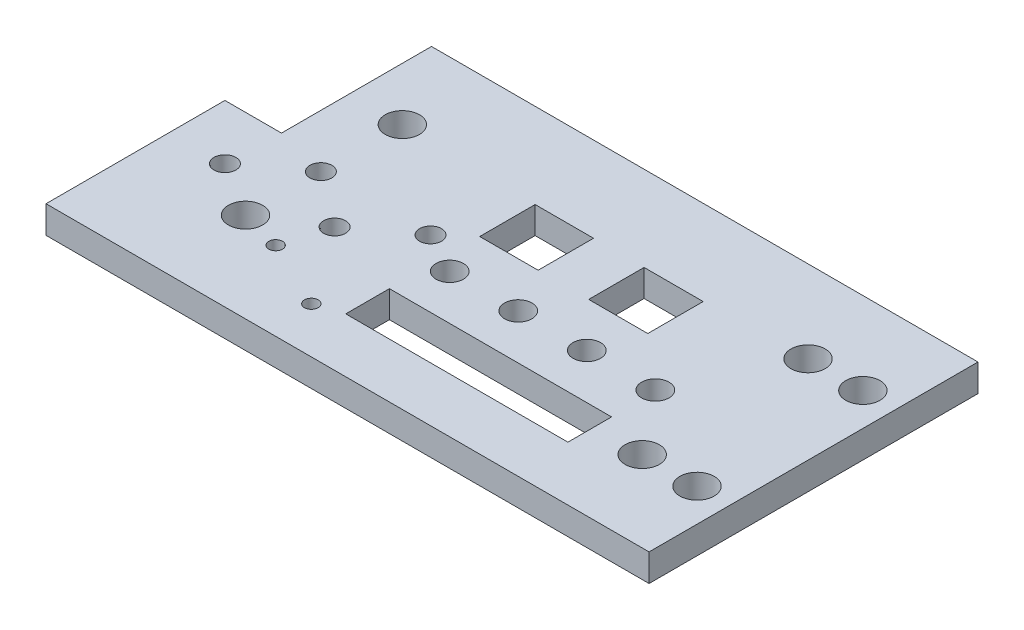
from build123d import *

# Parameters (mm, degrees)
SKETCH1_W                    = 220
SKETCH1_H                    = 120
BOSS_EXTRUDE1_DEPTH          = 10
CUT_EXTRUDE1_REACH           = 127.698
SKETCH2_W                    = 20.632503002
SKETCH2_H                    = 54.730004003
F_12_5_12_5_DIAMETER_HOLE1_D = 12.5
F_10_0_10_DIAMETER_HOLE1_D   = 10
F_5_0MM_DOWEL_HOLE1_D        = 5
CUT_EXTRUDE2_REACH           = 127.698
SKETCH12_R                   = 4
SKETCH12_W                   = 81.05559148
SKETCH12_H                   = 15.93559148
SKETCH12_W_2                 = 21.30559148
SKETCH12_H_2                 = 20.21559148
SKETCH12_W_3                 = 21.55559148
DRAFT1_ANGLE                 = -1


with BuildPart() as part:
    # Sketch1 → Boss-Extrude1 (new body)
    with BuildSketch(Plane(origin=(0, 0, 0), x_dir=(1, 0, 0), z_dir=(0, 1, 0))):
        Rectangle(SKETCH1_W, SKETCH1_H)
    extrude(amount=-BOSS_EXTRUDE1_DEPTH)

    # Sketch2 → Cut-Extrude1 (cut, up to next)
    with BuildSketch(Plane(origin=(0, 0, 0), x_dir=(1, 0, 0), z_dir=(0, 1, 0)), mode=Mode.PRIVATE) as cut_extrude1_sk1:
        with Locations((-99.683748499, 32.634997999)):
            Rectangle(SKETCH2_W, SKETCH2_H)
    cut_extrude1_tool1 = extrude(cut_extrude1_sk1.sketch, amount=-CUT_EXTRUDE1_REACH, mode=Mode.PRIVATE) & part.part
    add(cut_extrude1_tool1.solids().sort_by_distance((-99.683748, 0, -32.634998))[0], mode=Mode.SUBTRACT)

    # Ø12.5 (12.5) Diameter Hole1 (through all)
    with Locations(Plane(origin=(0, -10, 0), x_dir=(-1, 0, 0), z_dir=(0, -1, 0))):
        with Locations((-98, 30), (-78, 30), (70, 30), (-98, -30.5), (-78, -30.5), (70, -27.22)):
            Hole(F_12_5_12_5_DIAMETER_HOLE1_D / 2)

    # Ø10.0 (10) Diameter Hole1 (through all)
    with Locations(Plane(origin=(0, -10, 0), x_dir=(-1, 0, 0), z_dir=(0, -1, 0))):
        with Locations((-60, -7.72), (-35, -7.72), (-10, -7.72), (15, -7.72)):
            Hole(F_10_0_10_DIAMETER_HOLE1_D / 2)

    # Ø5.0mm Dowel Hole1 (through all)
    with Locations(Plane(origin=(0, -10, 0), x_dir=(-1, 0, 0), z_dir=(0, -1, 0))):
        with Locations((30, -43.22), (55, -31.22)):
            Hole(F_5_0MM_DOWEL_HOLE1_D / 2)

    # Sketch12 → Cut-Extrude2 (cut, up to next)
    with BuildSketch(Plane.XZ.offset(10), mode=Mode.PRIVATE) as cut_extrude2_sk1:
        with Locations((-90, 14.72)):
            Circle(SKETCH12_R)
    cut_extrude2_tool1 = extrude(cut_extrude2_sk1.sketch, amount=-CUT_EXTRUDE2_REACH, mode=Mode.PRIVATE) & part.part
    # Sketch12 → Cut-Extrude2 (cut, up to next)
    with BuildSketch(Plane.XZ.offset(10), mode=Mode.PRIVATE) as cut_extrude2_sk2:
        with Locations((-70, -0.28)):
            Circle(SKETCH12_R)
    cut_extrude2_tool2 = extrude(cut_extrude2_sk2.sketch, amount=-CUT_EXTRUDE2_REACH, mode=Mode.PRIVATE) & part.part
    # Sketch12 → Cut-Extrude2 (cut, up to next)
    with BuildSketch(Plane.XZ.offset(10), mode=Mode.PRIVATE) as cut_extrude2_sk3:
        with Locations((-50, 14.72)):
            Circle(SKETCH12_R)
    cut_extrude2_tool3 = extrude(cut_extrude2_sk3.sketch, amount=-CUT_EXTRUDE2_REACH, mode=Mode.PRIVATE) & part.part
    # Sketch12 → Cut-Extrude2 (cut, up to next)
    with BuildSketch(Plane.XZ.offset(10), mode=Mode.PRIVATE) as cut_extrude2_sk4:
        with Locations((-30, -0.28)):
            Circle(SKETCH12_R)
    cut_extrude2_tool4 = extrude(cut_extrude2_sk4.sketch, amount=-CUT_EXTRUDE2_REACH, mode=Mode.PRIVATE) & part.part
    # Sketch12 → Cut-Extrude2 (cut, up to next)
    with BuildSketch(Plane.XZ.offset(10), mode=Mode.PRIVATE) as cut_extrude2_sk5:
        with Locations((20, 32.16)):
            Rectangle(SKETCH12_W, SKETCH12_H)
    cut_extrude2_tool5 = extrude(cut_extrude2_sk5.sketch, amount=-CUT_EXTRUDE2_REACH, mode=Mode.PRIVATE) & part.part
    # Sketch12 → Cut-Extrude2 (cut, up to next)
    with BuildSketch(Plane.XZ.offset(10), mode=Mode.PRIVATE) as cut_extrude2_sk6:
        with Locations((-9.875, -18.86)):
            Rectangle(SKETCH12_W_2, SKETCH12_H_2)
    cut_extrude2_tool6 = extrude(cut_extrude2_sk6.sketch, amount=-CUT_EXTRUDE2_REACH, mode=Mode.PRIVATE) & part.part
    # Sketch12 → Cut-Extrude2 (cut, up to next)
    with BuildSketch(Plane.XZ.offset(10), mode=Mode.PRIVATE) as cut_extrude2_sk7:
        with Locations((30, -18.86)):
            Rectangle(SKETCH12_W_3, SKETCH12_H_2)
    cut_extrude2_tool7 = extrude(cut_extrude2_sk7.sketch, amount=-CUT_EXTRUDE2_REACH, mode=Mode.PRIVATE) & part.part
    add(cut_extrude2_tool1.solids().sort_by_distance((-90, -10, 14.72))[0], mode=Mode.SUBTRACT)
    add(cut_extrude2_tool2.solids().sort_by_distance((-70, -10, -0.28))[0], mode=Mode.SUBTRACT)
    add(cut_extrude2_tool3.solids().sort_by_distance((-50, -10, 14.72))[0], mode=Mode.SUBTRACT)
    add(cut_extrude2_tool4.solids().sort_by_distance((-30, -10, -0.28))[0], mode=Mode.SUBTRACT)
    add(cut_extrude2_tool5.solids().sort_by_distance((20, -10, 32.16))[0], mode=Mode.SUBTRACT)
    add(cut_extrude2_tool6.solids().sort_by_distance((-9.875, -10, -18.86))[0], mode=Mode.SUBTRACT)
    add(cut_extrude2_tool7.solids().sort_by_distance((30, -10, -18.86))[0], mode=Mode.SUBTRACT)

    # Draft1
    draft1_faces = [part.faces().sort_by_distance(p)[0] for p in [
        (60.52779574, -5, 32.16),
        (20, -5, 40.12779574),
        (-20.52779574, -5, 32.16),
        (20, -5, 24.19220426),
        (-9.875, -5, -8.75220426),
        (30, -5, -8.75220426),
        (40.77779574, -5, -18.86),
        (0.77779574, -5, -18.86),
        (-20.52779574, -5, -18.86),
        (19.22220426, -5, -18.86),
        (30, -5, -28.96779574),
        (-9.875, -5, -28.96779574),
        (-54, -5, 14.72),
        (-34, -5, -0.28),
        (-74, -5, -0.28),
        (-94, -5, 14.72),
    ]]
    draft(draft1_faces, Plane.ZX, DRAFT1_ANGLE)


solid = part.part
